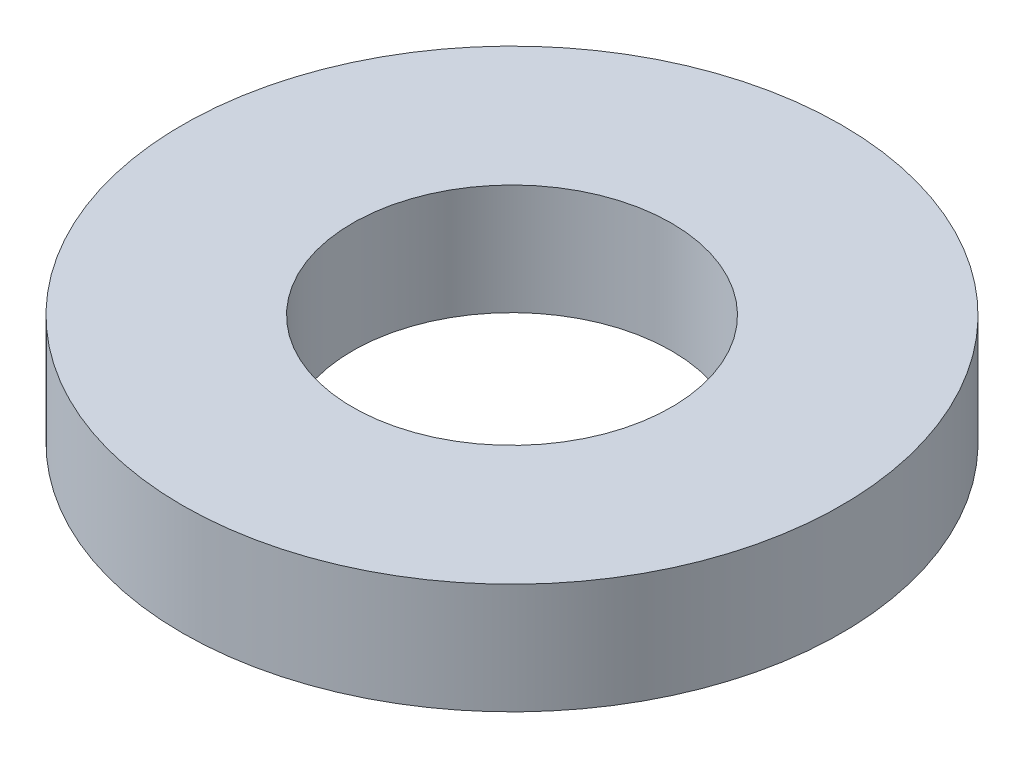
from build123d import *

# Parameters (mm, degrees)
SKETCH1_R           = 77.5
BOSS_EXTRUDE1_DEPTH = 26
SKETCH2_R           = 37.5
CUT_EXTRUDE1_DEPTH  = 113.643242141


with BuildPart() as part:
    # Sketch1 → Boss-Extrude1 (new body)
    with BuildSketch(Plane(origin=(0, 0, 0), x_dir=(1, 0, 0), z_dir=(0, 1, 0))):
        Circle(SKETCH1_R)
    extrude(amount=BOSS_EXTRUDE1_DEPTH)

    # Sketch2 → Cut-Extrude1 (cut, through all)
    with BuildSketch(Plane(origin=(0, 0, 0), x_dir=(1, 0, 0), z_dir=(0, 1, 0))):
        Circle(SKETCH2_R)
    extrude(amount=CUT_EXTRUDE1_DEPTH, mode=Mode.SUBTRACT)


solid = part.part
